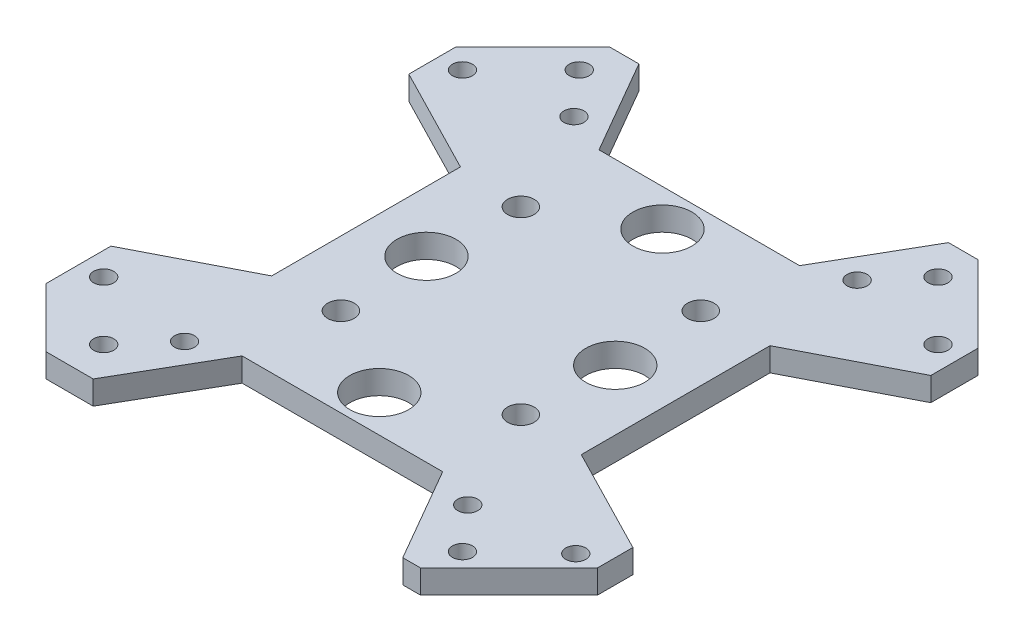
from build123d import *

# Parameters (mm, degrees)
SKETCH_1_R      = 2.25
SKETCH_1_R_2    = 1.7
SKETCH_1_R_3    = 5
SKETCH_1_R_4    = 1.69491354
EXTRUDE_1_DEPTH = 4


with BuildPart() as part:
    # 草图1 → 凸台-拉伸1 (new body)
    with BuildSketch(Plane(origin=(0, 0, 0), x_dir=(1, 0, 0), z_dir=(0, 1, 0))):
        Polygon((44.23849367, 33.250010702), (44.23849367, 25.250010702), (26.23849367, 16), (26.23849367, -16), (44.23849367, -25.250010702), (44.23849367, -31.250010702), (29.23849367, -46.250010702), (26.23849367, -46.250010702), (17, -30.248470281), (-17, -30.248470281), (-26.23849367, -46.250010702), (-34.23849367, -46.250010702), (-44.23849367, -36.250010702), (-44.23849367, -25.250010702), (-26.23849367, -16), (-26.23849367, 16), (-44.23849367, 25.250010702), (-44.23849367, 33.250010702), (-31.23849367, 46.250010702), (-26.23849367, 46.250010702), (-17, 30.248470281), (17, 30.248470281), (26.23849367, 46.250010702), (31.23849367, 46.250010702), align=None)
        with Locations((-15.25, -15.25)):
            Circle(SKETCH_1_R, mode=Mode.SUBTRACT)
        with Locations((-15.25, 15.25)):
            Circle(SKETCH_1_R, mode=Mode.SUBTRACT)
        with Locations((15.25, -15.25)):
            Circle(SKETCH_1_R, mode=Mode.SUBTRACT)
        with Locations((15.25, 15.25)):
            Circle(SKETCH_1_R, mode=Mode.SUBTRACT)
        with Locations((-24, -33)):
            Circle(SKETCH_1_R_2, mode=Mode.SUBTRACT)
        with Locations((-16, 0)):
            Circle(SKETCH_1_R_3, mode=Mode.SUBTRACT)
        with Locations((0, 24)):
            Circle(SKETCH_1_R_3, mode=Mode.SUBTRACT)
        with Locations((-30.40559154, -40.30508646)):
            Circle(SKETCH_1_R_2, mode=Mode.SUBTRACT)
        with Locations((-30.40559154, 40.30508646)):
            Circle(SKETCH_1_R_2, mode=Mode.SUBTRACT)
        with Locations((-40.30508646, 30.40559154)):
            Circle(SKETCH_1_R_2, mode=Mode.SUBTRACT)
        with Locations((30.40559154, -40.30508646)):
            Circle(SKETCH_1_R_2, mode=Mode.SUBTRACT)
        with Locations((40.30508646, -31)):
            Circle(SKETCH_1_R_4, mode=Mode.SUBTRACT)
        with Locations((40.30508646, 30.40559154)):
            Circle(SKETCH_1_R_4, mode=Mode.SUBTRACT)
        with Locations((30.40559154, 40.30508646)):
            Circle(SKETCH_1_R_2, mode=Mode.SUBTRACT)
        with Locations((-40.30508646, -30.40559154)):
            Circle(SKETCH_1_R_2, mode=Mode.SUBTRACT)
        with Locations((24, -33)):
            Circle(SKETCH_1_R_2, mode=Mode.SUBTRACT)
        with Locations((24, 33)):
            Circle(SKETCH_1_R_2, mode=Mode.SUBTRACT)
        with Locations((-24, 33)):
            Circle(SKETCH_1_R_2, mode=Mode.SUBTRACT)
        with Locations((16, 0)):
            Circle(SKETCH_1_R_3, mode=Mode.SUBTRACT)
        with Locations((0, -24)):
            Circle(SKETCH_1_R_3, mode=Mode.SUBTRACT)
    extrude(amount=EXTRUDE_1_DEPTH)


solid = part.part
